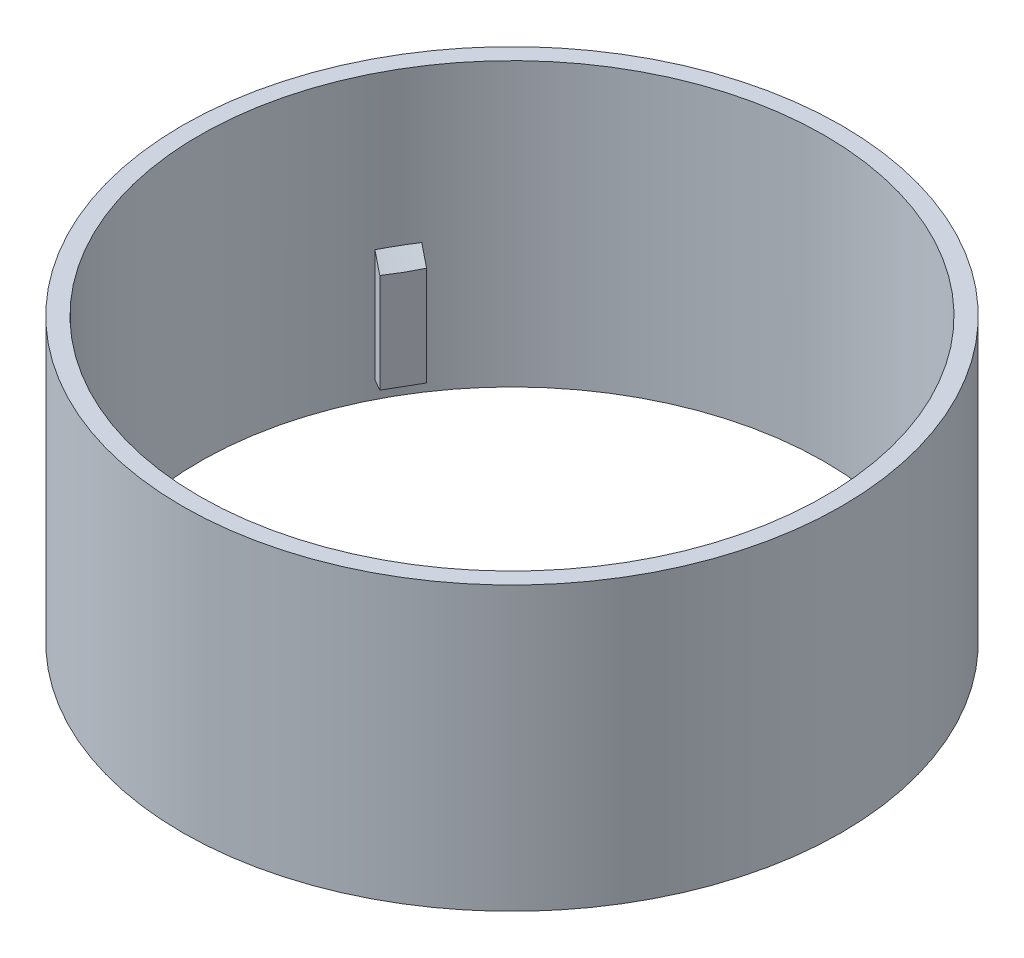
from build123d import *

# Parameters (mm, degrees)
SKETCH_1_R               = 38.5
SKETCH_1_R_2             = 36.5
EXTRUDE_1_DEPTH          = 40
EXTRUDE_3_DEPTH          = 1.6
PATTERN_CIRCULAR_1_COUNT = 3
SKETCH_3_R               = 52.927820275
CUT_EXTRUDE_1_DEPTH      = 7
CHAMFER_1_SIZE           = 1.7


with BuildPart() as part:
    # Эскиз1 → Бобышка-Вытянуть1 (new body)
    with BuildSketch(Plane(origin=(0, 0, 0), x_dir=(1, 0, 0), z_dir=(0, 1, 0))):
        with Locations(Location((0, 0, 0), (0, 0, 270))):
            Circle(SKETCH_1_R)
        with Locations(Location((0, 0, 0), (0, 0, 270))):
            Circle(SKETCH_1_R_2, mode=Mode.SUBTRACT)
    extrude(amount=EXTRUDE_1_DEPTH)

    # Эскиз2 → Бобышка-Вытянуть3 (add)
    with BuildSketch(Plane.XY.offset(36.5)):
        Polygon((1.95, 20.447072268), (-0.95, 20.447072268), (-2.05, 20.447072268), (-2.05, 9), (1.95, 9), align=None)
    extrude_3 = extrude(amount=-EXTRUDE_3_DEPTH)

    # Круговой массив1: Бобышка-Вытянуть3 ×3 about axis
    pattern_circular_1_axis = Axis((0, 0, 0), (0, 1, 0))
    for i in range(1, PATTERN_CIRCULAR_1_COUNT):
        add(extrude_3.rotate(pattern_circular_1_axis, i * 360 / PATTERN_CIRCULAR_1_COUNT))

    # Эскиз3 → Вырез-Вытянуть1 (cut)
    with BuildSketch(Plane.XZ):
        Circle(SKETCH_3_R)
    extrude(amount=-CUT_EXTRUDE_1_DEPTH, mode=Mode.SUBTRACT)

    # Фаска1
    # the kernel refuses this chamfer: 1.7 mm, written as the material it adds along each edge
    with BuildSketch(Plane(origin=(0, 20.447072268, 0), x_dir=(0, 0, 1), z_dir=(1, 0, 0))) as chamfer_1_piece_1_section:
        Polygon((36.5, -CHAMFER_1_SIZE), (36.5 - CHAMFER_1_SIZE, 0), (36.5, 0), align=None)
    chamfer_1_piece_1 = revolve(axis=Axis((0, 20.447072268, 0), (0, -1, 0)), revolution_arc=10.082397384, mode=Mode.PRIVATE)
    chamfer_1_piece_1 = split(chamfer_1_piece_1, bisect_by=Plane(origin=(-2.05, 21.014554038, 35.932884204), z_dir=(1, 0, 0)), keep=Keep.TOP, mode=Mode.PRIVATE)
    chamfer_1_piece_1 = split(chamfer_1_piece_1, bisect_by=Plane(origin=(-1.024016217, 21.014554038, 34.9), z_dir=(0, 0, 1)), keep=Keep.TOP, mode=Mode.PRIVATE)
    add(chamfer_1_piece_1)
    with BuildSketch(Plane(origin=(0, 20.447072268, 0), x_dir=(-0.9392452885856895, 0, -0.3432466866112253), z_dir=(-0.3432466866112253, 0, 0.9392452885856895))) as chamfer_1_piece_2_section:
        Polygon((36.5, -CHAMFER_1_SIZE), (36.5 - CHAMFER_1_SIZE, 0), (36.5, 0), align=None)
    chamfer_1_piece_2 = revolve(axis=Axis((0, 20.447072268, 0), (0, -1, 0)), revolution_arc=20.007603595, mode=Mode.PRIVATE)
    chamfer_1_piece_2 = split(chamfer_1_piece_2, bisect_by=Plane(origin=(-32.094466273, 21.014490137, -16.278082692), z_dir=(0.5000000000000004, 0, -0.8660254037844384)), keep=Keep.TOP, mode=Mode.PRIVATE)
    chamfer_1_piece_2 = split(chamfer_1_piece_2, bisect_by=Plane(origin=(-30.094466273, 21.014490137, -19.742184307), z_dir=(-0.5000000000000004, 0, 0.8660254037844384)), keep=Keep.TOP, mode=Mode.PRIVATE)
    chamfer_1_piece_2 = split(chamfer_1_piece_2, bisect_by=Plane(origin=(-30.199383778, 21.014490137, -17.493132939), z_dir=(-0.8660254037844384, 0, -0.5000000000000004)), keep=Keep.TOP, mode=Mode.PRIVATE)
    add(chamfer_1_piece_2)
    with BuildSketch(Plane(origin=(0, 20.447072268, 0), x_dir=(0.7668829946630015, 0, -0.6417869369944413), z_dir=(-0.6417869369944413, 0, -0.7668829946630015))) as chamfer_1_piece_3_section:
        Polygon((36.5, -CHAMFER_1_SIZE), (36.5 - CHAMFER_1_SIZE, 0), (36.5, 0), align=None)
    chamfer_1_piece_3 = revolve(axis=Axis((0, 20.447072268, 0), (0, -1, 0)), revolution_arc=20.007603595, mode=Mode.PRIVATE)
    chamfer_1_piece_3 = split(chamfer_1_piece_3, bisect_by=Plane(origin=(30.144466273, 21.014490137, -19.655581767), z_dir=(0.49999999999999983, 0, 0.8660254037844388)), keep=Keep.TOP, mode=Mode.PRIVATE)
    chamfer_1_piece_3 = split(chamfer_1_piece_3, bisect_by=Plane(origin=(32.144466273, 21.014490137, -16.191480152), z_dir=(-0.49999999999999983, 0, -0.8660254037844388)), keep=Keep.TOP, mode=Mode.PRIVATE)
    chamfer_1_piece_3 = split(chamfer_1_piece_3, bisect_by=Plane(origin=(30.249189406, 21.014490137, -17.406867061), z_dir=(0.8660254037844388, 0, -0.49999999999999983)), keep=Keep.TOP, mode=Mode.PRIVATE)
    add(chamfer_1_piece_3)
    with BuildSketch(Plane(origin=(0, 20.447072268, 0), x_dir=(0.17236211792697714, 0, 0.9850336544015776), z_dir=(0.9850336544015776, 0, -0.17236211792697714))) as chamfer_1_piece_4_section:
        Polygon((36.5, -CHAMFER_1_SIZE), (36.5 - CHAMFER_1_SIZE, 0), (36.5, 0), align=None)
    chamfer_1_piece_4 = revolve(axis=Axis((0, 20.447072268, 0), (0, -1, 0)), revolution_arc=9.925186074, mode=Mode.PRIVATE)
    chamfer_1_piece_4 = split(chamfer_1_piece_4, bisect_by=Plane(origin=(1.95, 21.014422977, 35.934484575), z_dir=(-1, 0, 0)), keep=Keep.TOP, mode=Mode.PRIVATE)
    chamfer_1_piece_4 = split(chamfer_1_piece_4, bisect_by=Plane(origin=(0.974165445, 21.014422977, 34.9), z_dir=(0, 0, 1)), keep=Keep.TOP, mode=Mode.PRIVATE)
    add(chamfer_1_piece_4)


solid = part.part
